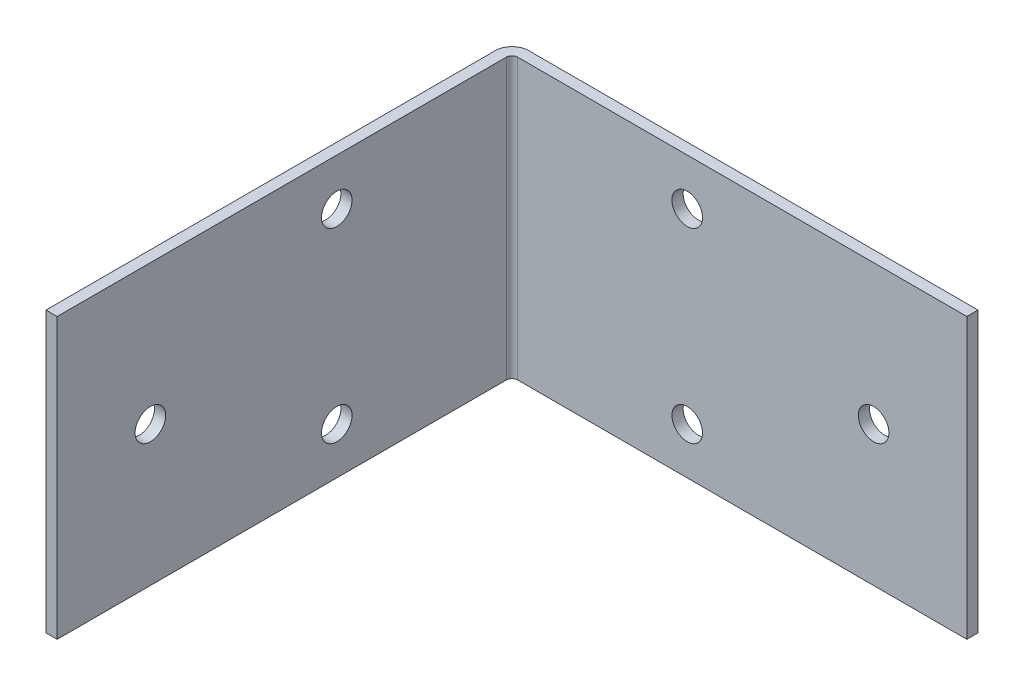
from build123d import *

# Parameters (mm, degrees)
EXTRUDE_THIN1_START = -19.05
EXTRUDE_THIN1_DEPTH = 38.1
SKETCH4_R           = 2.0828
EXTRUDE3_DEPTH      = 91.75338603


# Read off the part's stored shape, not the designer's step: Extrude-Thin1
with BuildPart() as part:
    # Extrude-Thin1 outline → Extrude-Thin1 (new body)
    with BuildSketch(Plane(origin=(0, 0, 0), x_dir=(1, 0, 0), z_dir=(0, 1, 0)).offset(EXTRUDE_THIN1_START)):
        with BuildLine():
            Line((2.286, -1.524), (63.5, -1.524))
            Line((63.5, -1.524), (63.5, 0))
            Line((63.5, 0), (2.286, 0))
            ThreePointArc((2.286, 0), (0.669553898, -0.669553898), (0, -2.286))
            Line((0, -2.286), (0, -63.5))
            Line((0, -63.5), (1.524, -63.5))
            Line((1.524, -63.5), (1.524, -2.286))
            ThreePointArc((1.524, -2.286), (1.747184633, -1.747184633), (2.286, -1.524))
        make_face()
    extrude(amount=EXTRUDE_THIN1_DEPTH)

    # Sketch4 → Extrude3 (cut, through all)
    with BuildSketch(Plane(origin=(1.524, 0, 0), x_dir=(0, 0, -1), z_dir=(1, 0, 0))):
        with Locations((-50.8, 0)):
            Circle(SKETCH4_R)
        with Locations((-25.4, 12.7)):
            Circle(SKETCH4_R)
        with Locations((-25.4, -12.7)):
            Circle(SKETCH4_R)
    extrude3 = extrude(amount=-EXTRUDE3_DEPTH, mode=Mode.SUBTRACT)

    # Mirror1: Extrude3 across plane
    add(extrude3.mirror(Plane(origin=(0, 0, 0), x_dir=(0.7071067811865465, 0, 0.7071067811865486), z_dir=(-0.7071067811865488, 0, 0.7071067811865464))), mode=Mode.SUBTRACT)


solid = part.part
